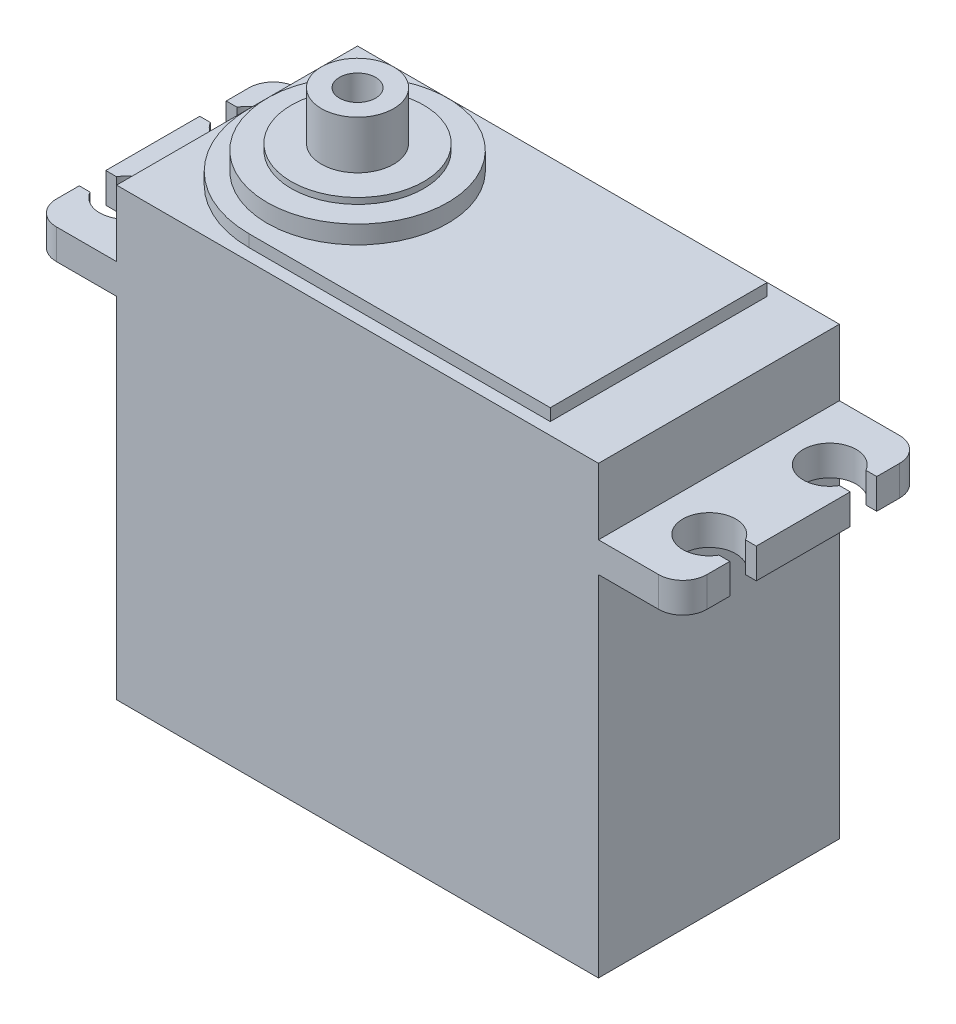
from build123d import *

# Parameters (mm, degrees)
SKETCH_1_W          = 40
SKETCH_1_H          = 20
EXTRUDE_1_DEPTH     = 37
SKETCH_2_W          = 54
SKETCH_2_H          = 20
EXTRUDE_2_DEPTH     = 2.5
SKETCH_3_R          = 2.2
CUT_EXTRUDE_1_DEPTH = 2.5
SKETCH_5_W          = 1.5
SKETCH_5_H          = 2.2
CUT_EXTRUDE_2_DEPTH = 2.5
FILLET_1_R          = 2
EXTRUDE_3_DEPTH     = 1
SKETCH_7_R          = 7.5
EXTRUDE_4_DEPTH     = 1.5
SKETCH_8_R          = 5.5
EXTRUDE_5_DEPTH     = 0.5
SKETCH_9_R          = 3
EXTRUDE_6_DEPTH     = 4
SKETCH_10_R         = 1.5
CUT_EXTRUDE_3_DEPTH = 5


with BuildPart() as part:
    # 草图1 → 凸台-拉伸1 (new body)
    with BuildSketch(Plane(origin=(0, 0, 0), x_dir=(1, 0, 0), z_dir=(0, 1, 0))):
        Rectangle(SKETCH_1_W, SKETCH_1_H)
    extrude(amount=EXTRUDE_1_DEPTH)

    # 草图2 → 凸台-拉伸2 (add)
    with BuildSketch(Plane(origin=(0, 29, 0), x_dir=(-1, 0, 0), z_dir=(0, -1, 0))):
        Rectangle(SKETCH_2_W, SKETCH_2_H)
    extrude(amount=-EXTRUDE_2_DEPTH)

    # 草图3 → 切除-拉伸1 (cut)
    with BuildSketch(Plane(origin=(0, 29, 0), x_dir=(-1, 0, 0), z_dir=(0, -1, 0))):
        with Locations((24.2, 5)):
            Circle(SKETCH_3_R)
        with Locations((-24.2, 5)):
            Circle(SKETCH_3_R)
        with Locations((24.2, -5)):
            Circle(SKETCH_3_R)
        with Locations((-24.2, -5)):
            Circle(SKETCH_3_R)
    extrude(amount=-CUT_EXTRUDE_1_DEPTH, mode=Mode.SUBTRACT)

    # 草图5 → 切除-拉伸2 (cut)
    with BuildSketch(Plane(origin=(0, 29, 0), x_dir=(-1, 0, 0), z_dir=(0, -1, 0))):
        with Locations((-26.25, 5)):
            Rectangle(SKETCH_5_W, SKETCH_5_H)
        with Locations((26.25, 5)):
            Rectangle(SKETCH_5_W, SKETCH_5_H)
        with Locations((26.25, -5)):
            Rectangle(SKETCH_5_W, SKETCH_5_H)
        with Locations((-26.25, -5)):
            Rectangle(SKETCH_5_W, SKETCH_5_H)
    extrude(amount=-CUT_EXTRUDE_2_DEPTH, mode=Mode.SUBTRACT)

    # 圆角1
    fillet_1_edges = [part.edges().sort_by_distance(p)[0] for p in [
        (27, 30.25, 10),
        (27, 30.25, -10),
        (-27, 30.25, 10),
        (-27, 30.25, -10),
    ]]
    fillet(fillet_1_edges, radius=FILLET_1_R)

    # 草图6 → 凸台-拉伸3 (add)
    with BuildSketch(Plane(origin=(0, 37, 0), x_dir=(1, 0, 0), z_dir=(0, 1, 0))):
        with BuildLine():
            Line((-10, 9), (15, 9))
            Line((15, 9), (15, -9))
            Line((15, -9), (-10, -9))
            ThreePointArc((-10, -9), (-19, 0), (-10, 9))
        make_face()
    extrude(amount=EXTRUDE_3_DEPTH)

    # 草图7 → 凸台-拉伸4 (add)
    with BuildSketch(Plane(origin=(0, 38, 0), x_dir=(1, 0, 0), z_dir=(0, 1, 0))):
        with Locations((-10, 0)):
            Circle(SKETCH_7_R)
    extrude(amount=EXTRUDE_4_DEPTH)

    # 草图8 → 凸台-拉伸5 (add)
    with BuildSketch(Plane(origin=(0, 39.5, 0), x_dir=(1, 0, 0), z_dir=(0, 1, 0))):
        with Locations((-10, 0)):
            Circle(SKETCH_8_R)
    extrude(amount=EXTRUDE_5_DEPTH)

    # 草图9 → 凸台-拉伸6 (add)
    with BuildSketch(Plane(origin=(0, 40, 0), x_dir=(1, 0, 0), z_dir=(0, 1, 0))):
        with Locations((-10, 0)):
            Circle(SKETCH_9_R)
    extrude(amount=EXTRUDE_6_DEPTH)

    # 草图10 → 切除-拉伸3 (cut)
    with BuildSketch(Plane(origin=(0, 44, 0), x_dir=(1, 0, 0), z_dir=(0, 1, 0))):
        with Locations((-10, 0)):
            Circle(SKETCH_10_R)
    extrude(amount=-CUT_EXTRUDE_3_DEPTH, mode=Mode.SUBTRACT)


solid = part.part
